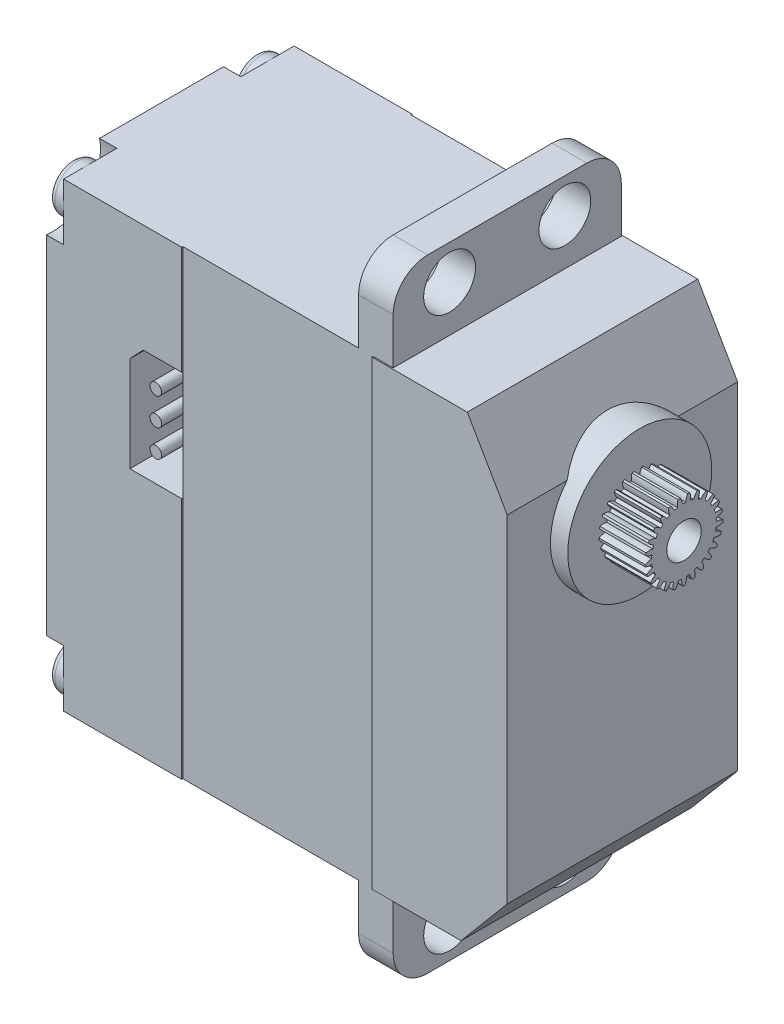
from build123d import *

# Parameters (mm, degrees)
SKETCH_1_W                     = 40
SKETCH_1_H                     = 40
EXTRUDE_1_DEPTH                = 20
SKETCH_2_R                     = 6.25
EXTRUDE_2_DEPTH                = 1.5
SKETCH_10_W                    = 16.5
SKETCH_10_H                    = 40
CUT_EXTRUDE_5_DEPTH            = 0.1
SKETCH_11_W                    = 16.5
SKETCH_11_H                    = 40
CUT_EXTRUDE_6_DEPTH            = 0.1
EXTRUDE_6_DEPTH                = 4
SKETCH_15_R                    = 1.5
CUT_EXTRUDE_9_DEPTH            = 4
CHAMFER_2_SIZE                 = 6
CHAMFER_2_SIZE_2               = 3.464101615
CHAMFER_3_SIZE                 = 4
CHAMFER_3_SIZE2                = 4.76701437
SKETCH_20_W                    = 3
SKETCH_20_H                    = 19.8
EXTRUDE_8_DEPTH                = 7
SKETCH_21_W                    = 3
SKETCH_21_H                    = 19.8
EXTRUDE_9_DEPTH                = 7
FILLET_4_R                     = 3
SKETCH_22_R                    = 2.25
CUT_EXTRUDE_12_DEPTH           = 7.3
CUT_EXTRUDE_13_DEPTH           = 1.5
SKETCH_25_R                    = 2
EXTRUDE_10_DEPTH               = 1.3
FILLET_5_R                     = 0.5
CUT_EXTRUDE_14_DEPTH           = 0.8
CUT_EXTRUDE_14_DRAFT           = -16
CUT_EXTRUDE_14_PROFILE_2_DEPTH = 0.8
CUT_EXTRUDE_14_PROFILE_2_DRAFT = -16
CUT_EXTRUDE_14_PROFILE_3_DEPTH = 0.8
CUT_EXTRUDE_14_PROFILE_3_DRAFT = -16
CUT_EXTRUDE_14_PROFILE_4_DEPTH = 0.8
CUT_EXTRUDE_14_PROFILE_4_DRAFT = -16
CUT_EXTRUDE_15_DEPTH           = 7
CUT_EXTRUDE_16_DEPTH           = 7
SKETCH_30_R                    = 0.5
EXTRUDE_11_DEPTH               = 5
EXTRUDE_START                  = 5
SKETCH_31_R                    = 0.5
EXTRUDE_12_DEPTH               = 5


with BuildPart() as part:
    # 草图1 → 凸台-拉伸1 (new body)
    with BuildSketch(Plane.XY):
        Rectangle(SKETCH_1_W, SKETCH_1_H)
    extrude(amount=EXTRUDE_1_DEPTH)

    # 草图2 → 凸台-拉伸2 (add)
    with BuildSketch(Plane(origin=(20, 0, 0), x_dir=(0, 0, -1), z_dir=(1, 0, 0))):
        with Locations(Location((-10, 10, 0), (0, 0, 180))):
            Circle(SKETCH_2_R)
    extrude(amount=EXTRUDE_2_DEPTH)

    # 草图10 → 切除-拉伸5 (cut)
    with BuildSketch(Plane(origin=(0, 0, 0), x_dir=(-1, 0, 0), z_dir=(0, 0, -1))):
        Rectangle(SKETCH_10_W, SKETCH_10_H)
    extrude(amount=-CUT_EXTRUDE_5_DEPTH, mode=Mode.SUBTRACT)

    # 草图11 → 切除-拉伸6 (cut)
    with BuildSketch(Plane.XY.offset(20)):
        Rectangle(SKETCH_11_W, SKETCH_11_H)
    extrude(amount=-CUT_EXTRUDE_6_DEPTH, mode=Mode.SUBTRACT)

    # 草图14 → 凸台-拉伸6 (add)
    with BuildSketch(Plane(origin=(21.5, 0, 0), x_dir=(0, 0, -1), z_dir=(1, 0, 0))):
        with BuildLine():
            ThreePointArc((-9.001803773, 13.072824063), (-9.190332602, 12.848308366), (-9.321381882, 12.586055618))
            ThreePointArc((-9.321381882, 12.586055618), (-9.456372375, 12.624330071), (-9.593104304, 12.655822077))
            ThreePointArc((-9.593104304, 12.655822077), (-9.581602438, 12.948769385), (-9.638650248, 13.236338446))
            ThreePointArc((-9.638650248, 13.236338446), (-9.732564329, 13.249545631), (-9.82681242, 13.260108856))
            ThreePointArc((-9.82681242, 13.260108856), (-9.953583485, 12.995761519), (-10.015296005, 12.709157293))
            ThreePointArc((-10.015296005, 12.709157293), (-10.155563992, 12.712658514), (-10.29583198, 12.709157293))
            ThreePointArc((-10.29583198, 12.709157293), (-10.357544499, 12.995761519), (-10.484315565, 13.260108856))
            ThreePointArc((-10.484315565, 13.260108856), (-10.578563656, 13.249545631), (-10.672477737, 13.236338446))
            ThreePointArc((-10.672477737, 13.236338446), (-10.729525547, 12.948769385), (-10.718023681, 12.655822077))
            ThreePointArc((-10.718023681, 12.655822077), (-10.85475561, 12.624330071), (-10.989746103, 12.586055618))
            ThreePointArc((-10.989746103, 12.586055618), (-11.120795382, 12.848308366), (-11.309324211, 13.072824063))
            ThreePointArc((-11.309324211, 13.072824063), (-11.397984358, 13.039154154), (-11.485663462, 13.003006415))
            ThreePointArc((-11.485663462, 13.003006415), (-11.469403493, 12.710284651), (-11.385409946, 12.42940122))
            ThreePointArc((-11.385409946, 12.42940122), (-11.510014447, 12.364894745), (-11.631245495, 12.294251983))
            ThreePointArc((-11.631245495, 12.294251983), (-11.823397227, 12.515674948), (-12.06183786, 12.686251859))
            ThreePointArc((-12.06183786, 12.686251859), (-12.139339219, 12.63159087), (-12.215274146, 12.574773872))
            ThreePointArc((-12.215274146, 12.574773872), (-12.126728071, 12.295292191), (-11.975520467, 12.044121574))
            ThreePointArc((-11.975520467, 12.044121574), (-12.080168181, 11.95065381), (-12.180022392, 11.852081485))
            ThreePointArc((-12.180022392, 11.852081485), (-12.421202977, 12.018761848), (-12.694573311, 12.124681997))
            ThreePointArc((-12.694573311, 12.124681997), (-12.756046187, 12.052464479), (-12.815465665, 11.978548244))
            ThreePointArc((-12.815465665, 11.978548244), (-12.66019716, 11.729867506), (-12.45127643, 11.524191679))
            ThreePointArc((-12.45127643, 11.524191679), (-12.529391955, 11.407635548), (-12.601595122, 11.287327321))
            ThreePointArc((-12.601595122, 11.287327321), (-12.876650296, 11.388791942), (-13.167773468, 11.423399977))
            ThreePointArc((-13.167773468, 11.423399977), (-13.209355294, 11.338163623), (-13.248525781, 11.251792578))
            ThreePointArc((-13.248525781, 11.251792578), (-13.036290937, 11.049538311), (-12.782784337, 10.90228064))
            ThreePointArc((-12.782784337, 10.90228064), (-12.829459388, 10.769959794), (-12.869474721, 10.635475073))
            ThreePointArc((-12.869474721, 10.635475073), (-13.161121755, 10.665348556), (-13.451705426, 10.626469928))
            ThreePointArc((-13.451705426, 10.626469928), (-13.470783464, 10.533570451), (-13.487243732, 10.440171607))
            ThreePointArc((-13.487243732, 10.440171607), (-13.231378045, 10.297052189), (-12.949214327, 10.217465417))
            ThreePointArc((-12.949214327, 10.217465417), (-12.961516139, 10.07769406), (-12.966829327, 9.937483015))
            ThreePointArc((-12.966829327, 9.937483015), (-13.256742967, 9.8938883), (-13.528528696, 9.783965895))
            ThreePointArc((-13.528528696, 9.783965895), (-13.523904201, 9.68924051), (-13.516619991, 9.594682461))
            ThreePointArc((-13.516619991, 9.594682461), (-13.233200443, 9.519690611), (-12.940108993, 9.512775467))
            ThreePointArc((-12.940108993, 9.512775467), (-12.917264598, 9.374335948), (-12.887541793, 9.237208556))
            ThreePointArc((-12.887541793, 9.237208556), (-13.157505698, 9.122884858), (-13.393416188, 8.948825505))
            ThreePointArc((-13.393416188, 8.948825505), (-13.365379735, 8.858226158), (-13.334808742, 8.768450333))
            ThreePointArc((-13.334808742, 8.768450333), (-13.041643625, 8.766298065), (-12.756040455, 8.832489053))
            ThreePointArc((-12.756040455, 8.832489053), (-12.69948525, 8.704080036), (-12.636594046, 8.578652513))
            ThreePointArc((-12.636594046, 8.578652513), (-12.869645391, 8.400783212), (-13.054857519, 8.1735237))
            ThreePointArc((-13.054857519, 8.1735237), (-13.005170741, 8.092743081), (-12.953233852, 8.013390425))
            ThreePointArc((-12.953233852, 8.013390425), (-12.66874381, 8.084212975), (-12.408574417, 8.219351071))
            ThreePointArc((-12.408574417, 8.219351071), (-12.321861974, 8.109040967), (-12.229754057, 8.003194387))
            ThreePointArc((-12.229754057, 8.003194387), (-12.411249369, 7.772955664), (-12.534125574, 7.506775545))
            ThreePointArc((-12.534125574, 7.506775545), (-12.465910475, 7.440889396), (-12.395871076, 7.376945929))
            ThreePointArc((-12.395871076, 7.376945929), (-12.137931663, 7.516293255), (-11.919543449, 7.711887236))
            ThreePointArc((-11.919543449, 7.711887236), (-11.808122229, 7.626607234), (-11.692585077, 7.546992327))
            ThreePointArc((-11.692585077, 7.546992327), (-11.811120338, 7.278850929), (-11.863939858, 6.990475278))
            ThreePointArc((-11.863939858, 6.990475278), (-11.781482642, 6.943623469), (-11.697741566, 6.899106994))
            ThreePointArc((-11.697741566, 6.899106994), (-11.482560065, 7.09822339), (-11.319675163, 7.341983367))
            ThreePointArc((-11.319675163, 7.341983367), (-11.190546172, 7.287091924), (-11.05883941, 7.238711187))
            ThreePointArc((-11.05883941, 7.238711187), (-11.106966614, 6.949515423), (-11.086410603, 6.657063943))
            ThreePointArc((-11.086410603, 6.657063943), (-10.994892362, 6.632190345), (-10.902711368, 6.609897996))
            ThreePointArc((-10.902711368, 6.609897996), (-10.743808424, 6.856272248), (-10.646661492, 7.132881885))
            ThreePointArc((-10.646661492, 7.132881885), (-10.507938378, 7.111828031), (-10.368337627, 7.097721404))
            ThreePointArc((-10.368337627, 7.097721404), (-10.343032763, 6.805642507), (-10.250392832, 6.527491))
            ThreePointArc((-10.250392832, 6.527491), (-10.155563992, 6.526158514), (-10.060735153, 6.527491))
            ThreePointArc((-10.060735153, 6.527491), (-9.968095221, 6.805642507), (-9.942790358, 7.097721404))
            ThreePointArc((-9.942790358, 7.097721404), (-9.803189606, 7.111828031), (-9.664466493, 7.132881885))
            ThreePointArc((-9.664466493, 7.132881885), (-9.567319561, 6.856272248), (-9.408416616, 6.609897996))
            ThreePointArc((-9.408416616, 6.609897996), (-9.316235623, 6.632190345), (-9.224717382, 6.657063943))
            ThreePointArc((-9.224717382, 6.657063943), (-9.204161371, 6.949515423), (-9.252288574, 7.238711187))
            ThreePointArc((-9.252288574, 7.238711187), (-9.120581812, 7.287091924), (-8.991452821, 7.341983367))
            ThreePointArc((-8.991452821, 7.341983367), (-8.828567919, 7.09822339), (-8.613386418, 6.899106994))
            ThreePointArc((-8.613386418, 6.899106994), (-8.529645342, 6.943623469), (-8.447188127, 6.990475278))
            ThreePointArc((-8.447188127, 6.990475278), (-8.500007647, 7.278850929), (-8.618542907, 7.546992327))
            ThreePointArc((-8.618542907, 7.546992327), (-8.503005756, 7.626607234), (-8.391584536, 7.711887236))
            ThreePointArc((-8.391584536, 7.711887236), (-8.173196321, 7.516293255), (-7.915256909, 7.376945929))
            ThreePointArc((-7.915256909, 7.376945929), (-7.84521751, 7.440889396), (-7.777002411, 7.506775545))
            ThreePointArc((-7.777002411, 7.506775545), (-7.899878616, 7.772955664), (-8.081373928, 8.003194387))
            ThreePointArc((-8.081373928, 8.003194387), (-7.98926601, 8.109040967), (-7.902553567, 8.219351071))
            ThreePointArc((-7.902553567, 8.219351071), (-7.642384175, 8.084212975), (-7.357894133, 8.013390425))
            ThreePointArc((-7.357894133, 8.013390425), (-7.305957244, 8.092743081), (-7.256270466, 8.1735237))
            ThreePointArc((-7.256270466, 8.1735237), (-7.441482594, 8.400783212), (-7.674533938, 8.578652513))
            ThreePointArc((-7.674533938, 8.578652513), (-7.611642734, 8.704080036), (-7.55508753, 8.832489053))
            ThreePointArc((-7.55508753, 8.832489053), (-7.269484359, 8.766298065), (-6.976319243, 8.768450333))
            ThreePointArc((-6.976319243, 8.768450333), (-6.94574825, 8.858226158), (-6.917711797, 8.948825505))
            ThreePointArc((-6.917711797, 8.948825505), (-7.153622287, 9.122884858), (-7.423586192, 9.237208556))
            ThreePointArc((-7.423586192, 9.237208556), (-7.393863387, 9.374335948), (-7.371018992, 9.512775467))
            ThreePointArc((-7.371018992, 9.512775467), (-7.077927541, 9.519690611), (-6.794507993, 9.594682461))
            ThreePointArc((-6.794507993, 9.594682461), (-6.787223784, 9.68924051), (-6.782599289, 9.783965895))
            ThreePointArc((-6.782599289, 9.783965895), (-7.054385018, 9.8938883), (-7.344298658, 9.937483015))
            ThreePointArc((-7.344298658, 9.937483015), (-7.349611845, 10.07769406), (-7.361913658, 10.217465417))
            ThreePointArc((-7.361913658, 10.217465417), (-7.07974994, 10.297052189), (-6.823884253, 10.440171607))
            ThreePointArc((-6.823884253, 10.440171607), (-6.840344521, 10.533570451), (-6.859422558, 10.626469928))
            ThreePointArc((-6.859422558, 10.626469928), (-7.15000623, 10.665348556), (-7.441653264, 10.635475073))
            ThreePointArc((-7.441653264, 10.635475073), (-7.481668597, 10.769959794), (-7.528343648, 10.90228064))
            ThreePointArc((-7.528343648, 10.90228064), (-7.274837048, 11.049538311), (-7.062602204, 11.251792578))
            ThreePointArc((-7.062602204, 11.251792578), (-7.10177269, 11.338163623), (-7.143354516, 11.423399977))
            ThreePointArc((-7.143354516, 11.423399977), (-7.434477689, 11.388791942), (-7.709532862, 11.287327321))
            ThreePointArc((-7.709532862, 11.287327321), (-7.78173603, 11.407635548), (-7.859851555, 11.524191679))
            ThreePointArc((-7.859851555, 11.524191679), (-7.650930824, 11.729867506), (-7.495662319, 11.978548244))
            ThreePointArc((-7.495662319, 11.978548244), (-7.555081798, 12.052464479), (-7.616554674, 12.124681997))
            ThreePointArc((-7.616554674, 12.124681997), (-7.889925008, 12.018761848), (-8.131105593, 11.852081485))
            ThreePointArc((-8.131105593, 11.852081485), (-8.230959804, 11.95065381), (-8.335607517, 12.044121574))
            ThreePointArc((-8.335607517, 12.044121574), (-8.184399914, 12.295292191), (-8.095853839, 12.574773872))
            ThreePointArc((-8.095853839, 12.574773872), (-8.171788766, 12.63159087), (-8.249290125, 12.686251859))
            ThreePointArc((-8.249290125, 12.686251859), (-8.487730757, 12.515674948), (-8.679882489, 12.294251983))
            ThreePointArc((-8.679882489, 12.294251983), (-8.801113538, 12.364894745), (-8.925718038, 12.42940122))
            ThreePointArc((-8.925718038, 12.42940122), (-8.841724492, 12.710284651), (-8.825464523, 13.003006415))
            ThreePointArc((-8.825464523, 13.003006415), (-8.913143627, 13.039154154), (-9.001803773, 13.072824063))
        make_face()
    extrude(amount=EXTRUDE_6_DEPTH)

    # 草图15 → 切除-拉伸9 (cut)
    with BuildSketch(Plane(origin=(25.5, 0, 0), x_dir=(0, 0, -1), z_dir=(1, 0, 0))):
        with Locations((-10.155563992, 9.901158514)):
            Circle(SKETCH_15_R)
    extrude(amount=-CUT_EXTRUDE_9_DEPTH, mode=Mode.SUBTRACT)

    # 倒角2
    # the kernel refuses this chamfer: 6, 3.464101615 mm, written as the material it takes off along each edge
    with BuildSketch(Plane(origin=(20, 20, -15.522514528), x_dir=(0.019326765612700865, -0.9998132206222078, 0), z_dir=(0, 0, 1))) as chamfer_2_piece_1_section:
        Polygon((CHAMFER_2_SIZE * 0.999813220622, -CHAMFER_2_SIZE * 0.0193267656127), (-CHAMFER_2_SIZE_2 * 0.0193267656135, -CHAMFER_2_SIZE_2 * 0.999813220662), (0, 0), align=None)
    chamfer_2_piece_1 = extrude(amount=51.045029056, mode=Mode.PRIVATE)
    chamfer_2_piece_1 = chamfer_2_piece_1 - Plane(origin=(18.872868859, 10, 10), x_dir=(0, 0, 1), z_dir=(-1, 0, 0)) * Cylinder(6.25, 127, mode=Mode.PRIVATE)
    add(chamfer_2_piece_1, mode=Mode.SUBTRACT)

    # 倒角3
    chamfer_3_edges = [part.edges().sort_by_distance(p)[0] for p in [
        (20, -20, 10),
    ]]
    chamfer_3_side = [part.faces().sort_by_distance(p)[0] for p in [
        (0, -20, 10),
    ]]
    chamfer(chamfer_3_edges, length=CHAMFER_3_SIZE, length2=CHAMFER_3_SIZE2, reference=chamfer_3_side[0])

    # 草图20 → 凸台-拉伸8 (add)
    with BuildSketch(Plane(origin=(0, -20, 0), x_dir=(-1, 0, 0), z_dir=(0, -1, 0))):
        with Locations((-8.5, -10)):
            Rectangle(SKETCH_20_W, SKETCH_20_H)
    extrude(amount=EXTRUDE_8_DEPTH)

    # 草图21 → 凸台-拉伸9 (add)
    with BuildSketch(Plane(origin=(0, 20, 0), x_dir=(1, 0, 0), z_dir=(0, 1, 0))):
        with Locations((8.5, -10)):
            Rectangle(SKETCH_21_W, SKETCH_21_H)
    extrude(amount=EXTRUDE_9_DEPTH)

    # 圆角4
    fillet_4_edges = [part.edges().sort_by_distance(p)[0] for p in [
        (8.5, 27, 19.9),
        (8.5, 27, 0.1),
        (8.5, -27, 19.9),
        (8.5, -27, 0.1),
    ]]
    fillet(fillet_4_edges, radius=FILLET_4_R)

    # 草图22 → 切除-拉伸12 (cut)
    with BuildSketch(Plane(origin=(10, 0, 0), x_dir=(0, 0, -1), z_dir=(1, 0, 0))):
        with Locations((-15, 24)):
            Circle(SKETCH_22_R)
        with Locations((-5, 24)):
            Circle(SKETCH_22_R)
        with Locations((-5, -24)):
            Circle(SKETCH_22_R)
        with Locations((-15, -24)):
            Circle(SKETCH_22_R)
    extrude(amount=-CUT_EXTRUDE_12_DEPTH, mode=Mode.SUBTRACT)

    # 草图24 → 切除-拉伸13 (cut)
    with BuildSketch(Plane.ZY.offset(20)):
        with BuildLine():
            Line((0, 15.059831138), (0, 20))
            Line((0, 20), (4.619724316, 20))
            ThreePointArc((4.619724316, 20), (3.582907294, 16.339446633), (0, 15.059831138))
        make_face()
        with BuildLine():
            Line((20, 15.059831138), (20, 20))
            Line((20, 20), (15.380275684, 20))
            ThreePointArc((15.380275684, 20), (16.417092706, 16.339446633), (20, 15.059831138))
        make_face()
        with BuildLine():
            Line((0, -20), (4.619724316, -20))
            ThreePointArc((4.619724316, -20), (3.582907294, -16.339446633), (0, -15.059831138))
            Line((0, -15.059831138), (0, -20))
        make_face()
        with BuildLine():
            Line((20, -20), (15.380275684, -20))
            ThreePointArc((15.380275684, -20), (16.417092706, -16.339446633), (20, -15.059831138))
            Line((20, -15.059831138), (20, -20))
        make_face()
    extrude(amount=-CUT_EXTRUDE_13_DEPTH, mode=Mode.SUBTRACT)

    # 草图25 → 凸台-拉伸10 (add)
    with BuildSketch(Plane.ZY.offset(18.5)):
        with Locations(Location((2.039859112, 17.947190939, 0), (0, 0, 180))):
            Circle(SKETCH_25_R)
        with Locations(Location((17.960140888, 17.947190939, 0), (0, 0, 180))):
            Circle(SKETCH_25_R)
        with Locations(Location((2.039859112, -17.947190939, 0), (0, 0, 180))):
            Circle(SKETCH_25_R)
        with Locations(Location((17.960140888, -17.947190939, 0), (0, 0, 180))):
            Circle(SKETCH_25_R)
    extrude(amount=EXTRUDE_10_DEPTH)

    # 圆角5
    fillet_5_edges = [part.edges().sort_by_distance(p)[0] for p in [
        (-19.8, 17.947190939, 4.039859112),
        (-19.8, 17.947190939, 19.960140888),
        (-19.8, -17.947190939, 4.039859112),
        (-19.8, -17.947190939, 19.960140888),
    ]]
    fillet(fillet_5_edges, radius=FILLET_5_R)


with BuildPart() as cut_extrude_14_tool:
    # 草图26 → 切除-拉伸14 (with draft: the straight prism first)
    with BuildSketch(Plane.ZY.offset(19.8)):
        Polygon((1.639859112, 18.347190939), (0.594175883, 18.347190939), (0.594175883, 17.547190939), (1.639859112, 17.547190939), (1.639859112, 16.501507709), (2.439859112, 16.501507709), (2.439859112, 17.547190939), (3.485542342, 17.547190939), (3.485542342, 18.347190939), (2.439859112, 18.347190939), (2.439859112, 19.392874168), (1.639859112, 19.392874168), align=None)
    extrude(amount=-CUT_EXTRUDE_14_DEPTH)
    # 切除-拉伸14: the draft: its side faces are tilted about the plane it starts from
    cut_extrude_14_sides = [cut_extrude_14_tool.faces().sort_by_distance(p)[0] for p in [
        (-19.4, 18.347190939, 1.117017497),
        (-19.4, 17.947190939, 0.594175883),
        (-19.4, 17.547190939, 1.117017497),
        (-19.4, 17.024349324, 1.639859112),
        (-19.4, 16.501507709, 2.039859112),
        (-19.4, 17.024349324, 2.439859112),
        (-19.4, 17.547190939, 2.962700727),
        (-19.4, 17.947190939, 3.485542342),
        (-19.4, 18.347190939, 2.962700727),
        (-19.4, 18.870032553, 2.439859112),
        (-19.4, 19.392874168, 2.039859112),
        (-19.4, 18.870032553, 1.639859112),
    ]]
    draft(cut_extrude_14_sides, Plane.ZY.offset(19.8), CUT_EXTRUDE_14_DRAFT)


with BuildPart() as part_1:
    add(part.part)

    # 切除-拉伸14: cut by cut_extrude_14_tool
    add(cut_extrude_14_tool.part, mode=Mode.SUBTRACT)


with BuildPart() as cut_extrude_14_profile_2_tool:
    # 草图26 → 切除-拉伸14 profile 2 (with draft: the straight prism first)
    with BuildSketch(Plane.ZY.offset(19.8)):
        Polygon((18.387715981, 18.347190939), (18.387715981, 19.392874168), (17.587715981, 19.392874168), (17.587715981, 18.347190939), (16.542032752, 18.347190939), (16.542032752, 17.547190939), (17.587715981, 17.547190939), (17.587715981, 16.501507709), (18.387715981, 16.501507709), (18.387715981, 17.547190939), (19.433399211, 17.547190939), (19.433399211, 18.347190939), align=None)
    extrude(amount=-CUT_EXTRUDE_14_PROFILE_2_DEPTH)
    # 切除-拉伸14 profile 2: the draft: its side faces are tilted about the plane it starts from
    cut_extrude_14_profile_2_sides = [cut_extrude_14_profile_2_tool.faces().sort_by_distance(p)[0] for p in [
        (-19.4, 18.870032553, 18.387715981),
        (-19.4, 19.392874168, 17.987715981),
        (-19.4, 18.870032553, 17.587715981),
        (-19.4, 18.347190939, 17.064874366),
        (-19.4, 17.947190939, 16.542032752),
        (-19.4, 17.547190939, 17.064874366),
        (-19.4, 17.024349324, 17.587715981),
        (-19.4, 16.501507709, 17.987715981),
        (-19.4, 17.024349324, 18.387715981),
        (-19.4, 17.547190939, 18.910557596),
        (-19.4, 17.947190939, 19.433399211),
        (-19.4, 18.347190939, 18.910557596),
    ]]
    draft(cut_extrude_14_profile_2_sides, Plane.ZY.offset(19.8), CUT_EXTRUDE_14_PROFILE_2_DRAFT)


with BuildPart() as part_2:
    add(part_1.part)

    # 切除-拉伸14 profile 2: cut by cut_extrude_14_profile_2_tool
    add(cut_extrude_14_profile_2_tool.part, mode=Mode.SUBTRACT)


with BuildPart() as cut_extrude_14_profile_3_tool:
    # 草图26 → 切除-拉伸14 profile 3 (with draft: the straight prism first)
    with BuildSketch(Plane.ZY.offset(19.8)):
        Polygon((18.387715981, -18.347190939), (19.433399211, -18.347190939), (19.433399211, -17.547190939), (18.387715981, -17.547190939), (18.387715981, -16.501507709), (17.587715981, -16.501507709), (17.587715981, -17.547190939), (16.542032752, -17.547190939), (16.542032752, -18.347190939), (17.587715981, -18.347190939), (17.587715981, -19.392874168), (18.387715981, -19.392874168), align=None)
    extrude(amount=-CUT_EXTRUDE_14_PROFILE_3_DEPTH)
    # 切除-拉伸14 profile 3: the draft: its side faces are tilted about the plane it starts from
    cut_extrude_14_profile_3_sides = [cut_extrude_14_profile_3_tool.faces().sort_by_distance(p)[0] for p in [
        (-19.4, -18.347190939, 18.910557596),
        (-19.4, -17.947190939, 19.433399211),
        (-19.4, -17.547190939, 18.910557596),
        (-19.4, -17.024349324, 18.387715981),
        (-19.4, -16.501507709, 17.987715981),
        (-19.4, -17.024349324, 17.587715981),
        (-19.4, -17.547190939, 17.064874366),
        (-19.4, -17.947190939, 16.542032752),
        (-19.4, -18.347190939, 17.064874366),
        (-19.4, -18.870032553, 17.587715981),
        (-19.4, -19.392874168, 17.987715981),
        (-19.4, -18.870032553, 18.387715981),
    ]]
    draft(cut_extrude_14_profile_3_sides, Plane.ZY.offset(19.8), CUT_EXTRUDE_14_PROFILE_3_DRAFT)


with BuildPart() as part_3:
    add(part_2.part)

    # 切除-拉伸14 profile 3: cut by cut_extrude_14_profile_3_tool
    add(cut_extrude_14_profile_3_tool.part, mode=Mode.SUBTRACT)


with BuildPart() as cut_extrude_14_profile_4_tool:
    # 草图26 → 切除-拉伸14 profile 4 (with draft: the straight prism first)
    with BuildSketch(Plane.ZY.offset(19.8)):
        Polygon((1.639859112, -18.347190939), (1.639859112, -19.392874168), (2.439859112, -19.392874168), (2.439859112, -18.347190939), (3.485542342, -18.347190939), (3.485542342, -17.547190939), (2.439859112, -17.547190939), (2.439859112, -16.501507709), (1.639859112, -16.501507709), (1.639859112, -17.547190939), (0.594175883, -17.547190939), (0.594175883, -18.347190939), align=None)
    extrude(amount=-CUT_EXTRUDE_14_PROFILE_4_DEPTH)
    # 切除-拉伸14 profile 4: the draft: its side faces are tilted about the plane it starts from
    cut_extrude_14_profile_4_sides = [cut_extrude_14_profile_4_tool.faces().sort_by_distance(p)[0] for p in [
        (-19.4, -18.870032553, 1.639859112),
        (-19.4, -19.392874168, 2.039859112),
        (-19.4, -18.870032553, 2.439859112),
        (-19.4, -18.347190939, 2.962700727),
        (-19.4, -17.947190939, 3.485542342),
        (-19.4, -17.547190939, 2.962700727),
        (-19.4, -17.024349324, 2.439859112),
        (-19.4, -16.501507709, 2.039859112),
        (-19.4, -17.024349324, 1.639859112),
        (-19.4, -17.547190939, 1.117017497),
        (-19.4, -17.947190939, 0.594175883),
        (-19.4, -18.347190939, 1.117017497),
    ]]
    draft(cut_extrude_14_profile_4_sides, Plane.ZY.offset(19.8), CUT_EXTRUDE_14_PROFILE_4_DRAFT)


with BuildPart() as part_4:
    add(part_3.part)

    # 切除-拉伸14 profile 4: cut by cut_extrude_14_profile_4_tool
    add(cut_extrude_14_profile_4_tool.part, mode=Mode.SUBTRACT)

    # 草图27 → 切除-拉伸15 (cut)
    with BuildSketch(Plane(origin=(0, 0, -1.9), x_dir=(-1, 0, 0), z_dir=(0, 0, -1))):
        Polygon((11.596503767, 10.6), (8.25, 10.6), (8.25, 1.1), (12.75, 1.1), (12.75, 9.367556241), align=None)
    extrude(amount=-CUT_EXTRUDE_15_DEPTH, mode=Mode.SUBTRACT)

    # 草图28 → 切除-拉伸16 (cut)
    with BuildSketch(Plane.XY.offset(22)):
        Polygon((-11.596503767, 10.6), (-12.75, 9.367556241), (-12.75, 1.1), (-8.25, 1.1), (-8.25, 10.6), align=None)
    extrude(amount=-CUT_EXTRUDE_16_DEPTH, mode=Mode.SUBTRACT)

    # 草图30 → 凸台-拉伸11 (add)
    with BuildSketch(Plane(origin=(0, 0, 5.1), x_dir=(-1, 0, 0), z_dir=(0, 0, -1))):
        with Locations((10.5, 8.225)):
            Circle(SKETCH_30_R)
        with Locations((10.5, 3.475)):
            Circle(SKETCH_30_R)
        with Locations((10.5, 5.85)):
            Circle(SKETCH_30_R)
    extrude(amount=EXTRUDE_11_DEPTH)

    # 草图31 → 凸台-拉伸12 (add)
    with BuildSketch(Plane.XY.offset(15).offset(EXTRUDE_START)):
        with Locations(Location((-10.5, 5.85, 0), (0, 0, 180))):
            Circle(SKETCH_31_R)
        with Locations(Location((-10.5, 3.475, 0), (0, 0, 180))):
            Circle(SKETCH_31_R)
        with Locations(Location((-10.5, 8.225, 0), (0, 0, 180))):
            Circle(SKETCH_31_R)
    extrude(amount=-EXTRUDE_12_DEPTH)


solid = part_4.part
